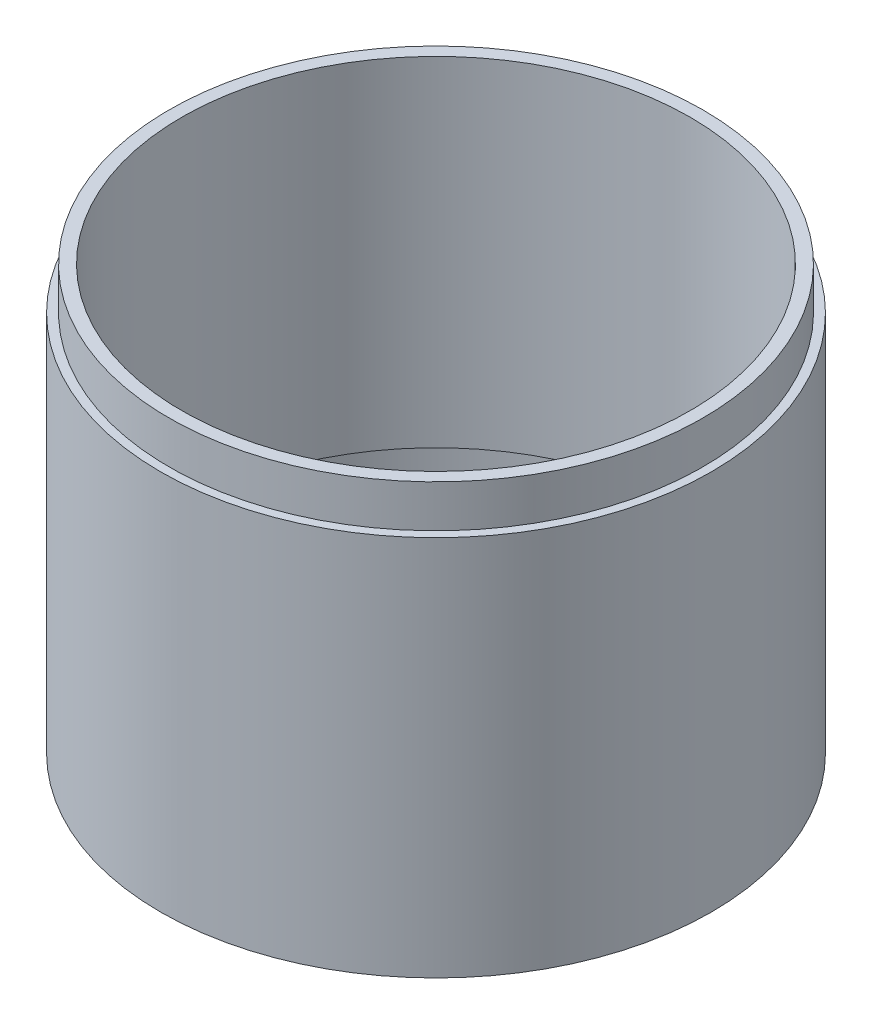
from build123d import *


with BuildPart() as part:
    # Szkic1 → Obrót1 (revolve)
    with BuildSketch(Plane.XY):
        Polygon((-65, 0), (-62, 0), (-62, 20), (-60, 20), (-60, 100), (-63, 100), (-63, 90), (-65, 90), (-65, 20), align=None)
    revolve(axis=Axis((0, 0, 0), (0, 1, 0)))


solid = part.part
